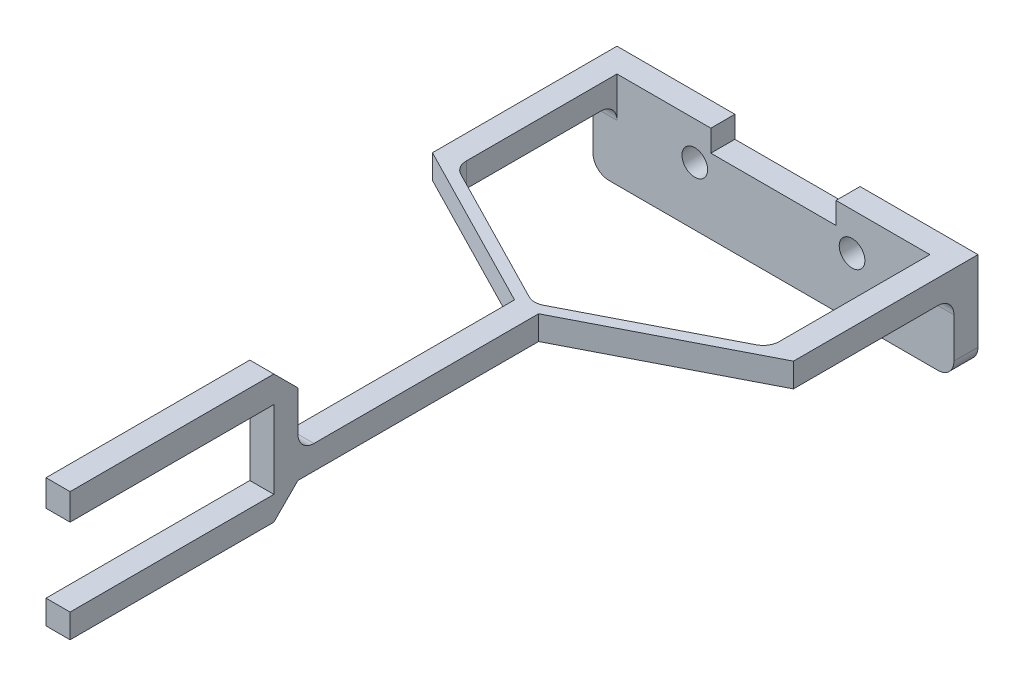
from build123d import *

# Parameters (mm, degrees)
SKETCH1_W                      = 45
SKETCH1_H                      = 12
BOSS_EXTRUDE1_DEPTH            = 3
SKETCH2_W                      = 3
SKETCH2_H                      = 12
BOSS_EXTRUDE2_DEPTH            = 20
BOSS_EXTRUDE3_DEPTH            = 12
CUT_EXTRUDE3_REACH             = 70.4
SKETCH4_W                      = 32.230769231
SKETCH4_H                      = 9
CUT_EXTRUDE4_REACH             = 70.4
SKETCH5_W                      = 30.769230769
SKETCH5_H                      = 9
CUT_EXTRUDE4_DIRECTION_2_REACH = 70.4
BOSS_EXTRUDE6_DEPTH            = 3
CHAMFER4_SIZE                  = 3
CHAMFER5_SIZE                  = 3
SKETCH9_W                      = 15.6
SKETCH9_H                      = 5.40390508
CUT_EXTRUDE5_DEPTH             = 3
SKETCH10_R                     = 1.6
CUT_EXTRUDE6_DEPTH             = 3
FILLET1_R                      = 2
FILLET2_R                      = 2
FILLET3_R                      = 2


with BuildPart() as part:
    # Sketch1 → Boss-Extrude1 (new body)
    with BuildSketch(Plane.XY):
        Rectangle(SKETCH1_W, SKETCH1_H)
    extrude(amount=BOSS_EXTRUDE1_DEPTH)

    # Sketch2 → Boss-Extrude2 (add)
    with BuildSketch(Plane.XY.offset(3)):
        with Locations((-21, 0)):
            Rectangle(SKETCH2_W, SKETCH2_H)
        with Locations((21, 0)):
            Rectangle(SKETCH2_W, SKETCH2_H)
    extrude(amount=BOSS_EXTRUDE2_DEPTH)

    # Sketch3 → Boss-Extrude3 (add)
    with BuildSketch(Plane(origin=(0, 6, 0), x_dir=(1, 0, 0), z_dir=(0, 1, 0))):
        Polygon((-19.5, -23), (0, -33), (19.5, -23), (22.5, -23), (1.5, -33.769230769), (1.5, -63.769230769), (-1.5, -63.769230769), (-1.5, -33.769230769), (-22.5, -23), align=None)
    extrude(amount=-BOSS_EXTRUDE3_DEPTH)

    # Cut-Extrude3: up to this face of the body (flat: up to its plane)
    cut_extrude3_end = Plane(part.part.faces().sort_by_distance((-1.5, 0, 48.769230769))[0])
    # Sketch4 → Cut-Extrude3 (cut, up to the picked face)
    with BuildSketch(Plane(origin=(1.5, 0, 0), x_dir=(0, 0, -1), z_dir=(1, 0, 0)), mode=Mode.PRIVATE) as cut_extrude3_sk1:
        with Locations((-49.884615385, -1.5)):
            Rectangle(SKETCH4_W, SKETCH4_H)
    cut_extrude3_tool1 = split(extrude(cut_extrude3_sk1.sketch, amount=-CUT_EXTRUDE3_REACH, mode=Mode.PRIVATE), bisect_by=cut_extrude3_end, keep=Keep.BOTH, mode=Mode.PRIVATE)
    add(cut_extrude3_tool1.solids().sort_by(Axis((1.5, -1.5, 49.884615), (-1, 0, 0)))[0], mode=Mode.SUBTRACT)

    # Cut-Extrude4: up to this face of the body (flat: up to its plane)
    cut_extrude4_end = Plane(part.part.faces().sort_by_distance((-22.5, 0, 11.5))[0])
    # Sketch5 → Cut-Extrude4 (cut, up to the picked face)
    with BuildSketch(Plane(origin=(1.5, 0, 0), x_dir=(0, 0, -1), z_dir=(1, 0, 0)), mode=Mode.PRIVATE) as cut_extrude4_sk1:
        with Locations((-18.384615385, -1.5)):
            Rectangle(SKETCH5_W, SKETCH5_H)
    cut_extrude4_tool1 = split(extrude(cut_extrude4_sk1.sketch, amount=-CUT_EXTRUDE4_REACH, mode=Mode.PRIVATE), bisect_by=cut_extrude4_end, keep=Keep.BOTH, mode=Mode.PRIVATE)
    add(cut_extrude4_tool1.solids().sort_by(Axis((1.5, -1.5, 18.384615), (-1, 0, 0)))[0], mode=Mode.SUBTRACT)

    # Cut-Extrude4 direction 2: up to this face of the body (flat: up to its plane)
    cut_extrude4_direction_2_end = Plane(part.part.faces().sort_by_distance((22.5, 0, 11.5))[0])
    # Sketch5 → Cut-Extrude4 direction 2 (cut, up to the picked face)
    with BuildSketch(Plane(origin=(1.5, 0, 0), x_dir=(0, 0, -1), z_dir=(1, 0, 0)), mode=Mode.PRIVATE) as cut_extrude4_direction_2_sk1:
        with Locations((-18.384615385, -1.5)):
            Rectangle(SKETCH5_W, SKETCH5_H)
    cut_extrude4_direction_2_tool1 = split(extrude(cut_extrude4_direction_2_sk1.sketch, amount=CUT_EXTRUDE4_DIRECTION_2_REACH, mode=Mode.PRIVATE), bisect_by=cut_extrude4_direction_2_end, keep=Keep.BOTH, mode=Mode.PRIVATE)
    add(cut_extrude4_direction_2_tool1.solids().sort_by(Axis((1.5, -1.5, 18.384615), (1, 0, 0)))[0], mode=Mode.SUBTRACT)

    # Sketch8 → Boss-Extrude6 (add)
    with BuildSketch(Plane.ZY.offset(1.5)):
        Polygon((63.769230769, 0), (92.169230769, 0), (92.169230769, 3), (66.769230769, 3), (66.769230769, 12.7), (92.169230769, 12.7), (92.169230769, 16), (85.741661946, 16), (63.769230769, 16), (63.769230769, 6), (63.769230769, 3), align=None)
    extrude(amount=-BOSS_EXTRUDE6_DEPTH)

    # Chamfer4
    chamfer4_edges = [part.edges().sort_by_distance(p)[0] for p in [
        (0, 16, 63.769230769),
    ]]
    chamfer(chamfer4_edges, length=CHAMFER4_SIZE)

    # Chamfer5
    chamfer5_edges = [part.edges().sort_by_distance(p)[0] for p in [
        (0, 0, 63.769230769),
    ]]
    chamfer(chamfer5_edges, length=CHAMFER5_SIZE - 0.0001)  # a hair under: the kernel refuses the full size

    # Sketch9 → Cut-Extrude5 (cut)
    with BuildSketch(Plane(origin=(0, 0, 0), x_dir=(-1, 0, 0), z_dir=(0, 0, -1))):
        with Locations((0, 6)):
            Rectangle(SKETCH9_W, SKETCH9_H)
    extrude(amount=-CUT_EXTRUDE5_DEPTH, mode=Mode.SUBTRACT)

    # Sketch10 → Cut-Extrude6 (cut)
    with BuildSketch(Plane(origin=(0, 0, 0), x_dir=(-1, 0, 0), z_dir=(0, 0, -1))):
        with Locations((-9.8, 1.29804746)):
            Circle(SKETCH10_R)
        with Locations((9.8, 1.29804746)):
            Circle(SKETCH10_R)
    extrude(amount=-CUT_EXTRUDE6_DEPTH, mode=Mode.SUBTRACT)

    # Fillet1
    fillet1_edges = [part.edges().sort_by_distance(p)[0] for p in [
        (19.5, 4.5, 23),
        (0, 6, 63.769230769),
        (0, 4.5, 33),
        (-19.5, 4.5, 23),
    ]]
    fillet(fillet1_edges, radius=FILLET1_R)

    # Fillet2
    fillet2_edges = [part.edges().sort_by_distance(p)[0] for p in [
        (21, 3, 3),
        (-21, 3, 3),
    ]]
    fillet(fillet2_edges, radius=FILLET2_R)

    # Fillet3
    fillet3_edges = [part.edges().sort_by_distance(p)[0] for p in [
        (-22.5, -6, 1.5),
        (22.5, -6, 1.5),
    ]]
    fillet(fillet3_edges, radius=FILLET3_R)


solid = part.part
